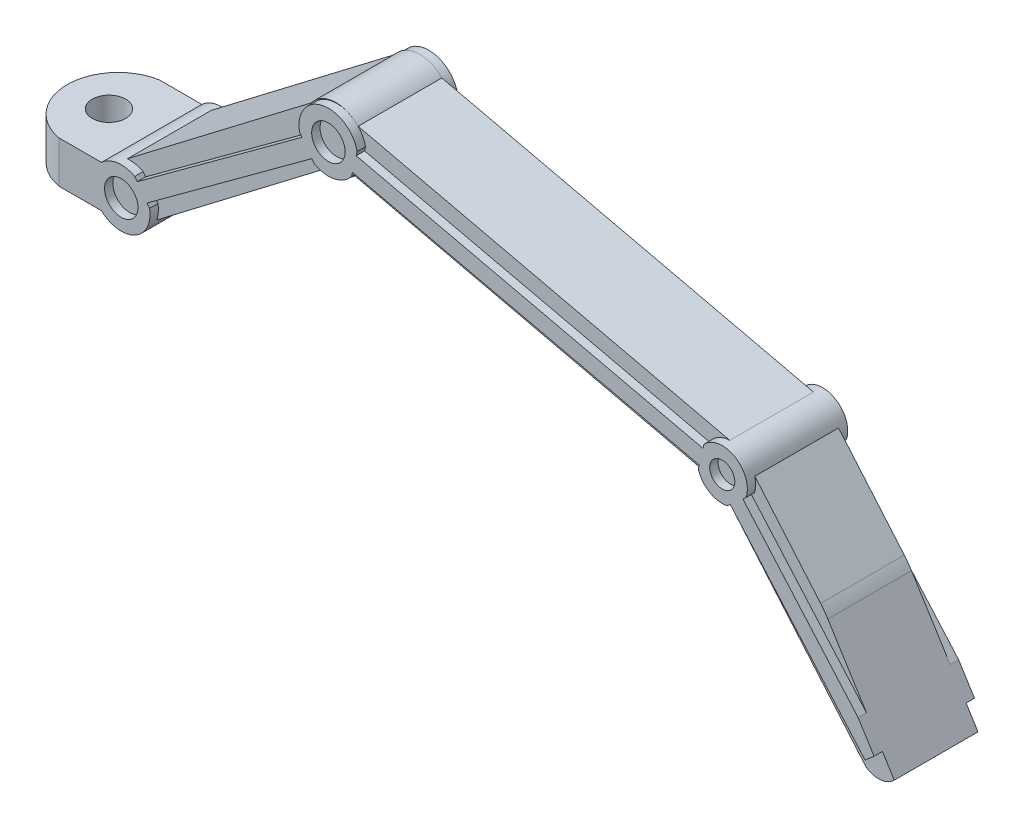
from build123d import *

# Parameters (mm, degrees)
AUFSATZ_LINEAR_AUSTRAGEN1_DEPTH      = 10
SKIZZE2_R                            = 2
SKIZZE2_R_2                          = 1.5
SCHNITT_LINEAR_AUSTRAGEN2_DEPTH      = 2
AUFSATZ_LINEAR_AUSTRAGEN3_DEPTH      = 1
AUFSATZ_LINEAR_AUSTRAGEN3_DEPTH_BACK = 11
SKIZZE3_R                            = 3.518752121
SKIZZE3_R_2                          = 2
SKIZZE3_R_3                          = 2.995079886
SKIZZE3_R_4                          = 1.5
SKIZZE3_R_5                          = 3.44111782
SKIZZE3_R_6                          = 2.0001213
AUFSATZ_LINEAR_START                 = 2
SKIZZE5_R                            = 2
SKIZZE5_R_2                          = 1.5
AUFSATZ_LINEAR_AUSTRAGEN4_DEPTH      = 2
AUFSATZ_LINEAR_AUSTRAGEN5_DEPTH      = 1
AUFSATZ_LINEAR_AUSTRAGEN5_DEPTH_BACK = 11
SCHNITT_LINEAR_START                 = -10
SCHNITT_LINEAR_AUSTRAGEN3_DEPTH      = 10
SCHNITT_LINEAR_AUSTRAGEN4_DEPTH      = 16
VERRUNDUNG1_R                        = 10
AUFSATZ_LINEAR_AUSTRAGEN7_DEPTH      = 5
AUFSATZ_LINEAR_AUSTRAGEN8_DEPTH      = 5
SCHNITT_LINEAR_AUSTRAGEN5_DEPTH      = 5
SCHNITT_LINEAR_START_2               = -12
SCHNITT_LINEAR_AUSTRAGEN6_DEPTH      = 12
AUFSATZ_LINEAR_AUSTRAGEN9_DEPTH      = 10
AUFSATZ_LINEAR_AUSTRAGEN10_DEPTH     = 5
SKIZZE15_R                           = 2
SCHNITT_LINEAR_AUSTRAGEN7_DEPTH      = 5


# Read off the part's stored shape, not the designer's step: Schnitt-Linear austragen3, Schnitt-Linear austragen6
with BuildPart() as part:
    # Skizze1 → Aufsatz-Linear austragen1 (new body)
    with BuildSketch(Plane.XY):
        with BuildLine():
            ThreePointArc((78.226909956, 8.062300015), (77.119029653, 9.691997481), (75.238373147, 10.280592164))
            Line((75.238373147, 10.280592164), (30.819907125, 20.574382651))
            ThreePointArc((30.819907125, 20.574382651), (27.95791063, 21.699717961), (25.256928729, 20.229309765))
            Line((25.256928729, 20.229309765), (2.03091053, 2.5))
            Line((2.03091053, 2.5), (-5, 2.5))
            Line((-5, 2.5), (-5, -2.5))
            Line((-5, -2.5), (5, -2.5))
            Line((5, -2.5), (27.32000509, 14.537715238))
            ThreePointArc((27.32000509, 14.537715238), (28.977073767, 14.52156508), (30.469248409, 15.242364824))
            Line((30.469248409, 15.242364824), (73.024030057, 5.38047526))
            ThreePointArc((73.024030057, 5.38047526), (73.783818165, 4.724277979), (74.717765038, 4.356017096))
            Line((74.717765038, 4.356017096), (91.568099076, -15.443205221))
            ThreePointArc((91.568099076, -15.443205221), (92.552334962, -16.00997429), (93.685100527, -16.092373528))
            Line((93.685100527, -16.092373528), (94.89559552, -15.062169177))
            Line((94.89559552, -15.062169177), (94.89559552, -11.523484486))
            Line((94.89559552, -11.523484486), (78.226909956, 8.062300015))
        make_face()
    extrude(amount=AUFSATZ_LINEAR_AUSTRAGEN1_DEPTH)

    # Skizze2 → Schnitt-Linear austragen2 (cut)
    with BuildSketch(Plane.XY.offset(10)):
        with Locations((28.266321665, 18.153414303)):
            Circle(SKIZZE2_R)
        with Locations((75.333906388, 7.287036264)):
            Circle(SKIZZE2_R_2)
    extrude(amount=-SCHNITT_LINEAR_AUSTRAGEN2_DEPTH, mode=Mode.SUBTRACT)

    # Skizze3 → Aufsatz-Linear austragen3 (add, two sides: drawn at the far end of the back side and taken through both)
    # profile 1 of 3: a face of its own
    with BuildSketch(Plane.XY.offset(10).offset(-AUFSATZ_LINEAR_AUSTRAGEN3_DEPTH_BACK)):
        with Locations(Location((28.266321665, 18.153414303, 0), (0, 0, 44.962482981))):
            Circle(SKIZZE3_R)
        with Locations((28.266321665, 18.153414303)):
            Circle(SKIZZE3_R_2, mode=Mode.SUBTRACT)
    # profile 2 of 3: a face of its own
    with BuildSketch(Plane.XY.offset(10).offset(-AUFSATZ_LINEAR_AUSTRAGEN3_DEPTH_BACK)):
        with Locations((75.333906388, 7.287036264)):
            Circle(SKIZZE3_R_3)
        with Locations((75.333906388, 7.287036264)):
            Circle(SKIZZE3_R_4, mode=Mode.SUBTRACT)
    # profile 3 of 3: a face of its own
    with BuildSketch(Plane.XY.offset(10).offset(-AUFSATZ_LINEAR_AUSTRAGEN3_DEPTH_BACK)):
        with Locations((3.511013625, 0)):
            Circle(SKIZZE3_R_5)
        with Locations((3.511013625, 0)):
            Circle(SKIZZE3_R_6, mode=Mode.SUBTRACT)
    extrude(amount=AUFSATZ_LINEAR_AUSTRAGEN3_DEPTH + AUFSATZ_LINEAR_AUSTRAGEN3_DEPTH_BACK)

    # Skizze5 → Aufsatz-Linear austragen4 (add)
    with BuildSketch(Plane.XY.offset(8).offset(AUFSATZ_LINEAR_START)):
        with Locations((28.266321665, 18.153414303)):
            Circle(SKIZZE5_R)
        with Locations((75.333906388, 7.287036264)):
            Circle(SKIZZE5_R_2)
    extrude(amount=-AUFSATZ_LINEAR_AUSTRAGEN4_DEPTH)

    # Skizze6 → Aufsatz-Linear austragen5 (add, two sides: drawn at the far end of the back side and taken through both)
    with BuildSketch(Plane.XY.offset(10).offset(-AUFSATZ_LINEAR_AUSTRAGEN5_DEPTH_BACK)):
        with BuildLine():
            ThreePointArc((5.121427356, 3.041029343), (5.76066726, 2.603910592), (6.285973792, 2.034917178))
            Line((6.285973792, 2.034917178), (25.428756233, 16.072587806))
            ThreePointArc((25.428756233, 16.072587806), (25.042779389, 16.742601882), (24.812464466, 17.480742804))
            Line((24.812464466, 17.480742804), (5.121427356, 3.041029343))
        make_face()
        with BuildLine():
            Line((25.428756233, 16.072587806), (6.285973792, 2.034917178))
            ThreePointArc((6.285973792, 2.034917178), (6.670742881, 1.362865688), (6.895487953, 0.621792068))
            Line((6.895487953, 0.621792068), (26.586525064, 15.061505529))
            ThreePointArc((26.586525064, 15.061505529), (25.951756527, 15.503054948), (25.428756233, 16.072587806))
        make_face()
        with BuildLine():
            Line((73.145381206, 9.33175166), (31.705187224, 18.898947778))
            ThreePointArc((31.705187224, 18.898947778), (31.765045144, 18.528314965), (31.785073786, 18.153414303))
            ThreePointArc((31.785073786, 18.153414303), (31.762454861, 17.755081316), (31.694888878, 17.361869386))
            Line((31.694888878, 17.361869386), (72.415589796, 7.96078087))
            ThreePointArc((72.415589796, 7.96078087), (72.690074235, 8.694393742), (73.145381206, 9.33175166))
        make_face()
        with BuildLine():
            ThreePointArc((31.694888878, 17.361869386), (31.439220556, 16.632122379), (31.030335836, 15.975837174))
            Line((31.030335836, 15.975837174), (72.470529818, 6.408641056))
            ThreePointArc((72.470529818, 6.408641056), (72.340701006, 7.181087839), (72.415589796, 7.96078087))
            Line((72.415589796, 7.96078087), (31.694888878, 17.361869386))
        make_face()
        Polygon((77.783811226, 6.765506884), (76.65509973, 5.777574519), (78.557461472, 3.604128601), (79.686172968, 4.592060966), align=None)
        Polygon((78.557461472, 3.604128601), (76.65509973, 5.777574519), (75.526388234, 4.789642153), (77.428749976, 2.616196235), align=None)
        Polygon((79.686172968, 4.592060966), (78.557461472, 3.604128601), (93.153708804, -13.072065775), (94.2824203, -12.084133409), align=None)
        Polygon((93.153708804, -13.072065775), (78.557461472, 3.604128601), (77.428749976, 2.616196235), (92.024997308, -14.059998141), align=None)
    extrude(amount=AUFSATZ_LINEAR_AUSTRAGEN5_DEPTH + AUFSATZ_LINEAR_AUSTRAGEN5_DEPTH_BACK)

    # Schnitt-Linear austragen3 outline → Schnitt-Linear austragen3 (cut)
    with BuildSketch(Plane.XY.offset(10).offset(SCHNITT_LINEAR_START)):
        Polygon((89.9130967, -7.092186645), (94.2824203, -12.084133409), (93.475427, -12.790474049), (94.89559552, -15.062169177), (94.89559552, -11.523484486), (86.561252738, -1.730592235), align=None)
        with BuildLine():
            Line((93.685100527, -16.092373528), (94.521004046, -15.380969147))
            ThreePointArc((94.521004046, -15.380969147), (93.054025889, -15.861614081), (91.568099076, -15.443205221))
            ThreePointArc((91.568099076, -15.443205221), (92.552334963, -16.00997429), (93.685100527, -16.092373528))
        make_face()
    extrude(amount=SCHNITT_LINEAR_AUSTRAGEN3_DEPTH, mode=Mode.SUBTRACT)

    # Skizze8 → Schnitt-Linear austragen4 (cut)
    with BuildSketch(Plane.XY.offset(11)):
        Polygon((89.9130967, -7.092186645), (93.475427, -12.790474049), (94.2824203, -12.084133409), align=None)
    extrude(amount=-SCHNITT_LINEAR_AUSTRAGEN4_DEPTH, mode=Mode.SUBTRACT)

    # Verrundung1
    verrundung1_edges = [part.edges().sort_by_distance(p)[0] for p in [
        (86.561252738, -1.730592235, 5),
    ]]
    fillet(verrundung1_edges, radius=VERRUNDUNG1_R)

    # Skizze9 → Aufsatz-Linear austragen7 (add)
    with BuildSketch(Plane(origin=(0, 2.5, 0), x_dir=(1, 0, 0), z_dir=(0, 1, 0))):
        with BuildLine():
            ThreePointArc((-8.85357764, -5.013698687), (-7.773533749, -8.117558236), (-5, -9.880495968))
            Line((-5, -9.880495968), (-5, -5.013698687))
            Line((-5, -5.013698687), (-8.85357764, -5.013698687))
        make_face()
        with BuildLine():
            Line((-5, -5.013698687), (-5, -0.146901406))
            ThreePointArc((-5, -0.146901406), (-7.773533749, -1.909839138), (-8.85357764, -5.013698687))
            Line((-8.85357764, -5.013698687), (-5, -5.013698687))
        make_face()
    extrude(amount=-AUFSATZ_LINEAR_AUSTRAGEN7_DEPTH)

    # Skizze10 → Aufsatz-Linear austragen8 (add)
    with BuildSketch(Plane(origin=(0, 2.5, 0), x_dir=(1, 0, 0), z_dir=(0, 1, 0))):
        with BuildLine():
            Line((-5, 0), (-5, -10))
            ThreePointArc((-5, -10), (-8.953952482, -5), (-5, 0))
        make_face()
    extrude(amount=-AUFSATZ_LINEAR_AUSTRAGEN8_DEPTH)

    # Skizze11 → Schnitt-Linear austragen5 (cut)
    with BuildSketch(Plane(origin=(0, 2.5, 0), x_dir=(1, 0, 0), z_dir=(0, 1, 0))):
        with BuildLine():
            ThreePointArc((-1.953952482, -5), (-2.539738919, -3.585786438), (-3.953952482, -3))
            Line((-3.953952482, -3), (-3.953952482, -5))
            Line((-3.953952482, -5), (-3.953952482, -7))
            ThreePointArc((-3.953952482, -7), (-2.539738919, -6.414213562), (-1.953952482, -5))
        make_face()
        with BuildLine():
            Line((-3.953952482, -5), (-3.953952482, -3))
            ThreePointArc((-3.953952482, -3), (-5.368166044, -3.585786438), (-5.953952482, -5))
            Line((-5.953952482, -5), (-3.953952482, -5))
        make_face()
        with BuildLine():
            Line((-3.953952482, -7), (-3.953952482, -5))
            Line((-3.953952482, -5), (-5.953952482, -5))
            ThreePointArc((-5.953952482, -5), (-5.368166044, -6.414213562), (-3.953952482, -7))
        make_face()
    extrude(amount=-SCHNITT_LINEAR_AUSTRAGEN5_DEPTH, mode=Mode.SUBTRACT)

    # Schnitt-Linear austragen6 outline → Schnitt-Linear austragen6 (cut)
    with BuildSketch(Plane(origin=(0, 0, -1), x_dir=(-1, 0, 0), z_dir=(0, 0, -1)).offset(SCHNITT_LINEAR_START_2)):
        Polygon((-77.793786947, 5.994948355), (-78.170024112, 6.324259144), (-89.9130967, -7.092186645), (-91.57392964, -9.748847489), align=None)
        Polygon((-76.288838286, 4.677705201), (-92.401234473, -13.730687352), (-92.024997308, -14.059998141), (-75.91260112, 4.348394412), align=None)
        with BuildLine():
            Line((-72.582920831, 6.895845592), (-72.470529818, 6.408641056))
            Line((-72.470529818, 6.408641056), (-31.030335836, 15.975837174))
            ThreePointArc((-31.030335836, 15.975837174), (-31.027817601, 15.972644557), (-31.025295678, 15.969454852))
            Line((-31.025295678, 15.969454852), (-31.138333921, 16.456510082))
            Line((-31.138333921, 16.456510082), (-72.582920831, 6.895845592))
        make_face()
        Polygon((-31.592711992, 18.411762677), (-31.705187224, 18.898947778), (-73.145381206, 9.33175166), (-73.032905974, 8.84456656), align=None)
        Polygon((-26.290848297, 15.464711741), (-26.586525064, 15.061505529), (-6.895487953, 0.621792068), (-6.599811187, 1.02499828), align=None)
        Polygon((-25.108141233, 17.077536592), (-5.417104122, 2.637823131), (-5.121427356, 3.041029343), (-24.812464466, 17.480742804), align=None)
    extrude(amount=SCHNITT_LINEAR_AUSTRAGEN6_DEPTH, mode=Mode.SUBTRACT)

    # Skizze13 → Aufsatz-Linear austragen9 (add)
    with BuildSketch(Plane(origin=(0, 0, 0), x_dir=(-1, 0, 0), z_dir=(0, 0, -1))):
        Polygon((-72.470529818, 6.408641056), (-30.276833668, 16.149796374), (-30.951685056, 19.072906978), (-73.145381206, 9.33175166), align=None)
        Polygon((-4.770111289, 2.783404349), (-6.544171886, 0.364167073), (-26.586525064, 15.061505529), (-24.812464466, 17.480742804), align=None)
        Polygon((-89.387726685, -6.251807151), (-91.57392964, -9.748847489), (-77.793786947, 5.994948355), (-78.170024112, 6.324259144), align=None)
        Polygon((-92.401234473, -13.730687352), (-92.024997308, -14.059998141), (-75.91260112, 4.348394412), (-75.457587491, 4.868246916), (-75.833824656, 5.197557705), align=None)
    extrude(amount=-AUFSATZ_LINEAR_AUSTRAGEN9_DEPTH)

    # Skizze14 → Aufsatz-Linear austragen10 (add)
    with BuildSketch(Plane(origin=(0, 2.5, 0), x_dir=(1, 0, 0), z_dir=(0, 1, 0))):
        with BuildLine():
            Line((-5, 0), (1.14642236, 0))
            Line((1.14642236, 0), (1.14642236, 1))
            Line((1.14642236, 1), (-5, 1))
            ThreePointArc((-5, 1), (-7.876578934, -1.407168944), (-8.95395245, -5))
            ThreePointArc((-8.953952482, -5), (-7.846018042, -1.812770003), (-5, 0))
        make_face()
        with BuildLine():
            Line((1.14642236, -11), (1.14642236, -10))
            Line((1.14642236, -10), (-5, -10))
            ThreePointArc((-5, -10), (-7.846018042, -8.187229997), (-8.953952482, -5))
            ThreePointArc((-8.95395245, -5), (-7.876578934, -8.592831056), (-5, -11))
            Line((-5, -11), (1.14642236, -11))
        make_face()
    extrude(amount=-AUFSATZ_LINEAR_AUSTRAGEN10_DEPTH)

    # Skizze15 → Schnitt-Linear austragen7 (cut)
    with BuildSketch(Plane(origin=(0, 2.5, 0), x_dir=(1, 0, 0), z_dir=(0, 1, 0))):
        with BuildLine():
            ThreePointArc((-8.95395245, -4.999999793), (-7.5401022, -1.094875093), (-3.953952482, 1))
            Line((-3.953952482, 1), (-5, 1))
            ThreePointArc((-5, 1), (-7.876578877, -1.407168858), (-8.95395245, -4.999999793))
        make_face()
        with BuildLine():
            ThreePointArc((-3.953952482, -11), (-7.540102332, -8.905124748), (-8.95395245, -4.999999793))
            ThreePointArc((-8.95395245, -4.999999793), (-7.87657899, -8.592830969), (-5, -11))
            Line((-5, -11), (-3.953952482, -11))
        make_face()
        with Locations(Location((-3.953952482, -5, 0), (0, 0, 270))):
            Circle(SKIZZE15_R)
    extrude(amount=-SCHNITT_LINEAR_AUSTRAGEN7_DEPTH, mode=Mode.SUBTRACT)


solid = part.part
